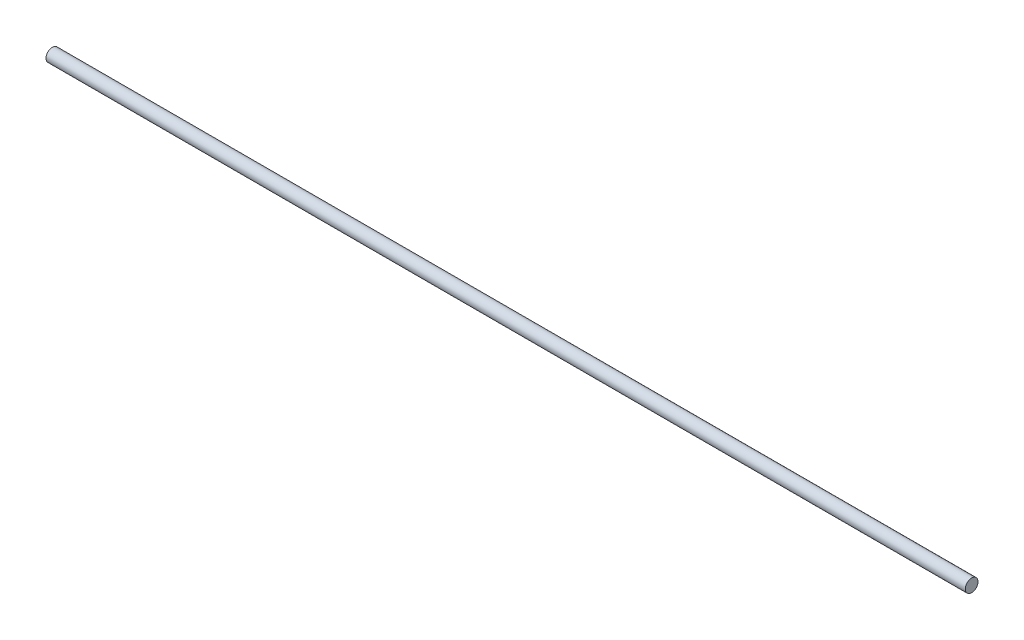
from build123d import *

# Parameters (mm, degrees)
SKETCH1_R           = 6.35
BOSS_EXTRUDE1_DEPTH = 914.4


with BuildPart() as part:
    # Sketch1 → Boss-Extrude1 (new body)
    with BuildSketch(Plane(origin=(0, 0, 0), x_dir=(0, 0, -1), z_dir=(1, 0, 0))):
        Circle(SKETCH1_R)
    extrude(amount=BOSS_EXTRUDE1_DEPTH)


solid = part.part
